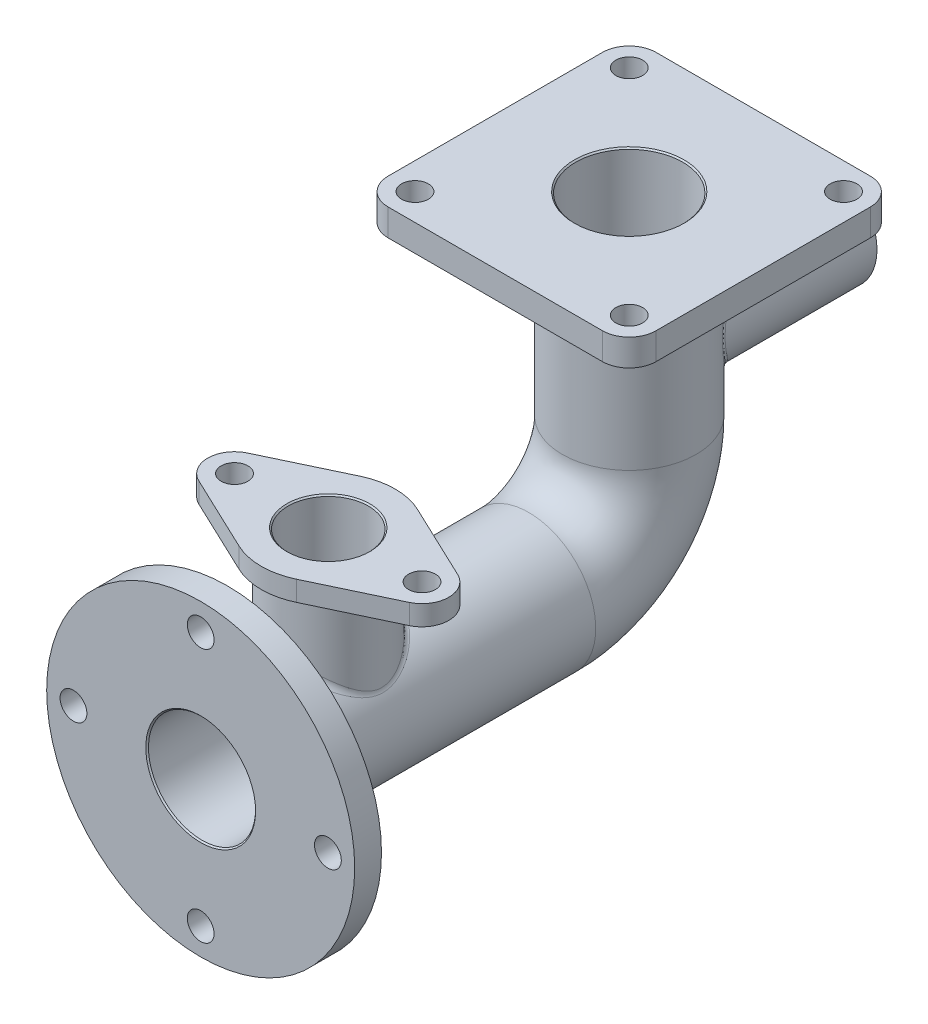
from build123d import *

# Parameters (mm, degrees)
SKETCH2_R                = 50
SKETCH2_R_2              = 40
SKETCH4_R                = 115
SKETCH4_R_2              = 40
SKETCH4_R_3              = 10
BOSS_EXTRUDE1_DEPTH      = 20
BOSS_EXTRUDE2_START      = 20
SKETCH5_R                = 40
SKETCH5_R_2              = 10
BOSS_EXTRUDE2_DEPTH      = 20
BOSS_EXTRUDE5_REACH      = 477.526
BOSS_EXTRUDE5_END_RADIUS = 50
SKETCH9_R                = 40
SKETCH9_R_2              = 30
SKETCH10_R               = 30
CUT_EXTRUDE7_DEPTH       = 90.5
SKETCH11_R               = 30
SKETCH11_R_2             = 10
BOSS_EXTRUDE6_DEPTH      = 15
BOSS_EXTRUDE7_REACH      = 529.115
BOSS_EXTRUDE7_END_RADIUS = 50
SKETCH12_R               = 40
SKETCH12_R_2             = 30
SKETCH14_R               = 30
CUT_EXTRUDE8_DEPTH       = 142
FILLET1_R                = 5
FILLET2_R                = 5
FILLET3_R                = 5
CHAMFER1_SIZE            = 1
FILLET4_R                = 1


with BuildPart() as part:
    # Sweep1: sweep along a path in Sketch3
    with BuildLine(Plane(origin=(0, 0, 0), x_dir=(0, 0, -1), z_dir=(1, 0, 0))) as sweep1_path:
        Line((0, 0), (225, 0))
        ThreePointArc((225, 0), (278.033008589, 21.966991411), (300, 75))
        Line((300, 75), (300, 200))
    # Sketch2 → Sweep1 (sweep)
    with BuildSketch(Plane.XY):
        Circle(SKETCH2_R)
        Circle(SKETCH2_R_2, mode=Mode.SUBTRACT)
    sweep(path=sweep1_path.line)

    # Sketch4 → Boss-Extrude1 (add)
    with BuildSketch(Plane.XY):
        Circle(SKETCH4_R)
        Circle(SKETCH4_R_2, mode=Mode.SUBTRACT)
        with Locations((95, 0)):
            Circle(SKETCH4_R_3, mode=Mode.SUBTRACT)
        with Locations((0, 95)):
            Circle(SKETCH4_R_3, mode=Mode.SUBTRACT)
        with Locations((0, -95)):
            Circle(SKETCH4_R_3, mode=Mode.SUBTRACT)
        with Locations((-95, 0)):
            Circle(SKETCH4_R_3, mode=Mode.SUBTRACT)
    extrude(amount=BOSS_EXTRUDE1_DEPTH)

    # Sketch5 → Boss-Extrude2 (add)
    with BuildSketch(Plane(origin=(0, 200, 0), x_dir=(1, 0, 0), z_dir=(0, 1, 0)).offset(BOSS_EXTRUDE2_START)):
        with BuildLine():
            Line((-80, 400), (80, 400))
            ThreePointArc((80, 400), (94.142135624, 394.142135624), (100, 380))
            Line((100, 380), (100, 220))
            ThreePointArc((100, 220), (94.142135624, 205.857864376), (80, 200))
            Line((80, 200), (-80, 200))
            ThreePointArc((-80, 200), (-94.142135624, 205.857864376), (-100, 220))
            Line((-100, 220), (-100, 380))
            ThreePointArc((-100, 380), (-94.142135624, 394.142135624), (-80, 400))
        make_face()
        with Locations((0, 300)):
            Circle(SKETCH5_R, mode=Mode.SUBTRACT)
        with Locations((-80, 220)):
            Circle(SKETCH5_R_2, mode=Mode.SUBTRACT)
        with Locations((-80, 380)):
            Circle(SKETCH5_R_2, mode=Mode.SUBTRACT)
        with Locations((80, 380)):
            Circle(SKETCH5_R_2, mode=Mode.SUBTRACT)
        with Locations((80, 220)):
            Circle(SKETCH5_R_2, mode=Mode.SUBTRACT)
    extrude(amount=-BOSS_EXTRUDE2_DEPTH)

    # Boss-Extrude5: up to this cylinder (the profile starts outside it)
    boss_extrude5_end = Plane(origin=(0, 0, -75.257097), z_dir=(0, 0, -1)) * Cylinder(BOSS_EXTRUDE5_END_RADIUS, 1056.052, mode=Mode.PRIVATE)
    # Sketch9 → Boss-Extrude5 (add, up to the surface)
    with BuildSketch(Plane(origin=(0, 115, 0), x_dir=(1, 0, 0), z_dir=(0, 1, 0)), mode=Mode.PRIVATE) as boss_extrude5_sk1:
        with Locations((0, 75.257097058)):
            Circle(SKETCH9_R)
        with Locations((0, 75.257097058)):
            Circle(SKETCH9_R_2, mode=Mode.SUBTRACT)
    boss_extrude5_tool1 = extrude(boss_extrude5_sk1.sketch, amount=-BOSS_EXTRUDE5_REACH, mode=Mode.PRIVATE) - boss_extrude5_end
    add(boss_extrude5_tool1.solids().sort_by_distance((-38.868629, 115, -75.257097))[0])

    # Sketch10 → Cut-Extrude7 (cut, symmetric)
    with BuildSketch(Plane(origin=(0, 115, 0), x_dir=(1, 0, 0), z_dir=(0, 1, 0))):
        with Locations((0, 75.257097058)):
            Circle(SKETCH10_R)
    extrude(amount=CUT_EXTRUDE7_DEPTH, both=True, mode=Mode.SUBTRACT)

    # Sketch11 → Boss-Extrude6 (add)
    with BuildSketch(Plane(origin=(0, 115, 0), x_dir=(1, 0, 0), z_dir=(0, 1, 0))):
        with BuildLine():
            Line((-78.571428571, 93.327255116), (-21.428571429, 120.432492203))
            ThreePointArc((-21.428571429, 120.432492203), (0, 125.257097058), (21.428571429, 120.432492203))
            Line((21.428571429, 120.432492203), (78.571428571, 93.327255116))
            ThreePointArc((78.571428571, 93.327255116), (90, 75.257097058), (78.571428571, 57.186939))
            Line((78.571428571, 57.186939), (21.428571429, 30.081701913))
            ThreePointArc((21.428571429, 30.081701913), (0, 25.257097058), (-21.428571429, 30.081701913))
            Line((-21.428571429, 30.081701913), (-78.571428571, 57.186939))
            ThreePointArc((-78.571428571, 57.186939), (-90, 75.257097058), (-78.571428571, 93.327255116))
        make_face()
        with Locations((0, 75.257097058)):
            Circle(SKETCH11_R, mode=Mode.SUBTRACT)
        with Locations((-70, 75.257097058)):
            Circle(SKETCH11_R_2, mode=Mode.SUBTRACT)
        with Locations((70, 75.257097058)):
            Circle(SKETCH11_R_2, mode=Mode.SUBTRACT)
    extrude(amount=-BOSS_EXTRUDE6_DEPTH)

    # Boss-Extrude7: up to this cylinder (the profile starts outside it)
    boss_extrude7_end = Plane(origin=(0, 130, -300), z_dir=(0, 1, 0)) * Cylinder(BOSS_EXTRUDE7_END_RADIUS, 1159.23, mode=Mode.PRIVATE)
    # Sketch12 → Boss-Extrude7 (add, up to the surface)
    with BuildSketch(Plane.XY.offset(-445), mode=Mode.PRIVATE) as boss_extrude7_sk1:
        with Locations((0, 130)):
            Circle(SKETCH12_R)
        with Locations((0, 130)):
            Circle(SKETCH12_R_2, mode=Mode.SUBTRACT)
    boss_extrude7_tool1 = extrude(boss_extrude7_sk1.sketch, amount=BOSS_EXTRUDE7_REACH, mode=Mode.PRIVATE) - boss_extrude7_end
    add(boss_extrude7_tool1.solids().sort_by_distance((-38.868629, 130, -445))[0])

    # Sketch14 → Cut-Extrude8 (cut, symmetric)
    with BuildSketch(Plane.XY.offset(-445)):
        with Locations((0, 130)):
            Circle(SKETCH14_R)
    extrude(amount=CUT_EXTRUDE8_DEPTH, both=True, mode=Mode.SUBTRACT)

    # Fillet1
    fillet1_edges = [part.edges().sort_by_distance(p)[0] for p in [
        (-40, 30, -75.257097058),
    ]]
    fillet(fillet1_edges, radius=FILLET1_R)

    # Fillet2
    fillet2_edges = [part.edges().sort_by_distance(p)[0] for p in [
        (-50, 0, 0),
    ]]
    fillet(fillet2_edges, radius=FILLET2_R)

    # Fillet3
    fillet3_edges = [part.edges().sort_by_distance(p)[0] for p in [
        (-50, 200, -300),
        (-40, 130, -330),
    ]]
    fillet(fillet3_edges, radius=FILLET3_R)

    # Chamfer1
    chamfer1_edges = [part.edges().sort_by_distance(p)[0] for p in [
        (-30, 115, -75.257097058),
        (-40, 0, 20),
        (-40, 220, -300),
    ]]
    chamfer(chamfer1_edges, length=CHAMFER1_SIZE)

    # Fillet4
    fillet4_edges = [part.edges().sort_by_distance(p)[0] for p in [
        (-30, 130, -445),
    ]]
    fillet(fillet4_edges, radius=FILLET4_R)


solid = part.part
